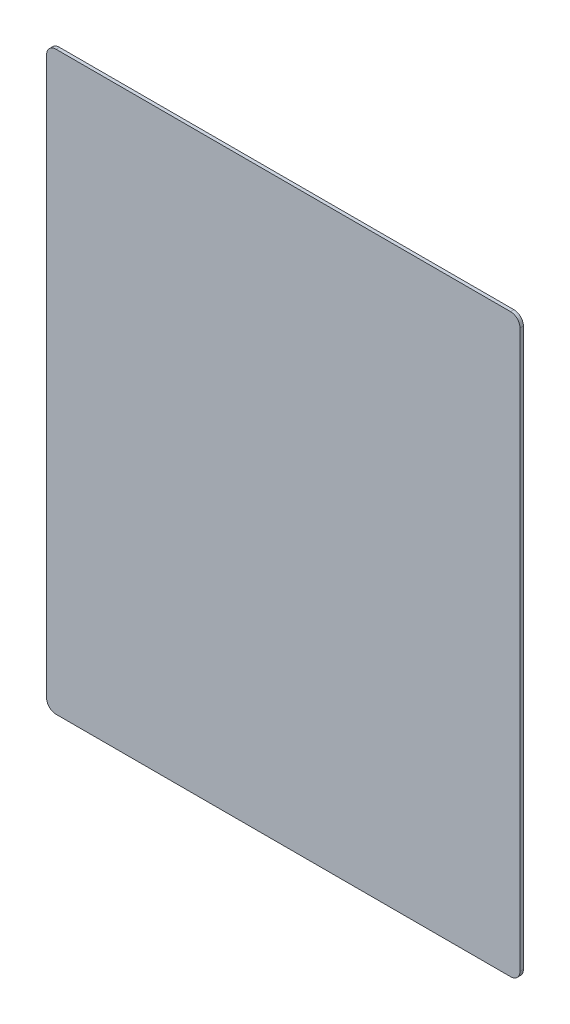
from build123d import *

# Parameters (mm, degrees)
SKETCH_1_W      = 70.11
SKETCH_1_H      = 85.3
EXTRUDE_1_DEPTH = 0.5
SKETCH_1_3_W    = 68.11
SKETCH_1_3_H    = 81.3
EXTRUDE_2_DEPTH = 0.7
FILLET_1_R      = 1.4
FILLET_2_R      = 1.4
SKETCH_1_4_W    = 13
SKETCH_1_4_H    = 4.5
EXTRUDE_3_DEPTH = 1


with BuildPart() as part:
    # 草图1 → 凸台-拉伸1 (new body)
    with BuildSketch(Plane.XY):
        with Locations((-3.095661812, -6.162041577)):
            Rectangle(SKETCH_1_W, SKETCH_1_H)
    extrude(amount=EXTRUDE_1_DEPTH)

    # 草图1<3> → 凸台-拉伸2 (add)
    with BuildSketch(Plane.XY):
        with Locations((-3.095661812, -6.162041577)):
            Rectangle(SKETCH_1_3_W, SKETCH_1_3_H)
    extrude(amount=-EXTRUDE_2_DEPTH)

    # 圆角1
    fillet_1_edges = [part.edges().sort_by_distance(p)[0] for p in [
        (30.959338188, -46.812041577, -0.35),
        (-37.150661812, -46.812041577, -0.35),
        (30.959338188, 34.487958423, -0.35),
        (-37.150661812, 34.487958423, -0.35),
    ]]
    fillet(fillet_1_edges, radius=FILLET_1_R)

    # 圆角2
    fillet_2_edges = [part.edges().sort_by_distance(p)[0] for p in [
        (-38.150661812, -48.812041577, 0.25),
        (31.959338188, -48.812041577, 0.25),
        (31.959338188, 36.487958423, 0.25),
        (-38.150661812, 36.487958423, 0.25),
    ]]
    fillet(fillet_2_edges, radius=FILLET_2_R)

    # 草图1<4> → 凸台-拉伸3 (add)
    with BuildSketch(Plane.XY):
        with Locations((-12.141661812, 12.437958423)):
            Rectangle(SKETCH_1_4_W, SKETCH_1_4_H)
    extrude(amount=-EXTRUDE_3_DEPTH)


solid = part.part
